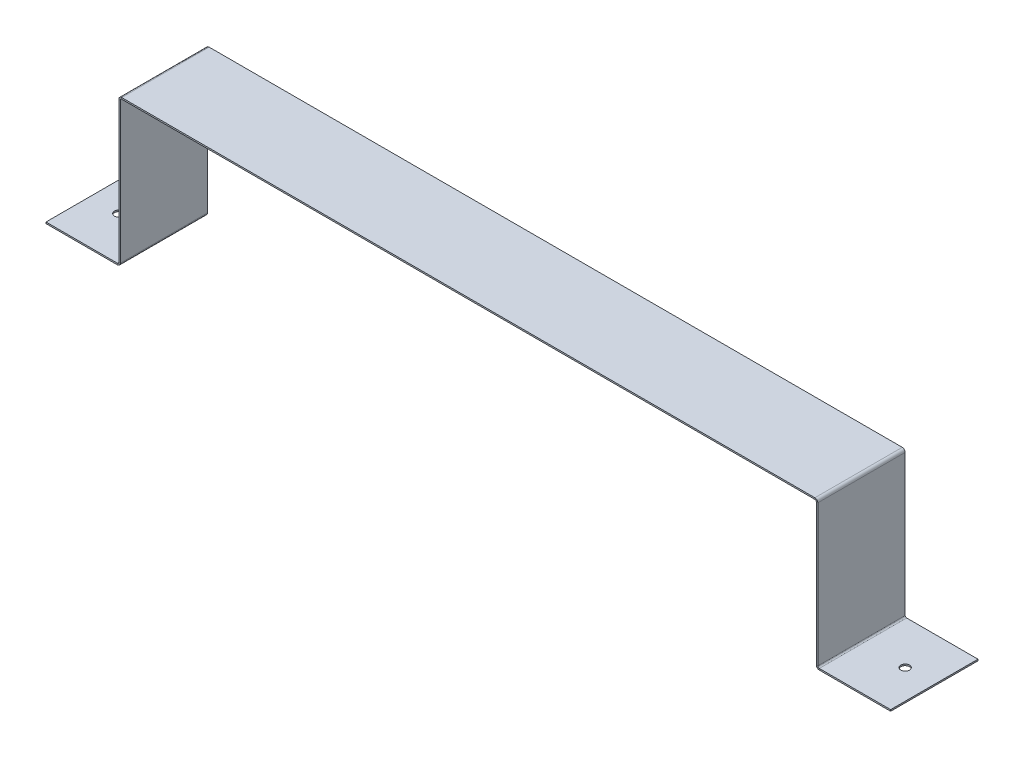
from build123d import *

# Parameters (mm, degrees)
BASE_FLANGE1_DEPTH = 30
SKETCH6_R          = 1.5
CUT_EXTRUDE1_DEPTH = 10


# Sheet-metal steps are written as plain solids
with BuildPart() as part:
    # Sketch1 → Base-Flange1 (new body)
    with BuildSketch(Plane.XY):
        with BuildLine():
            Line((-145, 0), (-120.5, 0))
            ThreePointArc((-120.5, 0), (-120.146446609, 0.146446609), (-120, 0.5))
            Line((-120, 0.5), (-120, 49))
            ThreePointArc((-120, 49), (-119.707106781, 49.707106781), (-119, 50))
            Line((-119, 50), (119, 50))
            ThreePointArc((119, 50), (119.707106781, 49.707106781), (120, 49))
            Line((120, 49), (120, 0.5))
            ThreePointArc((120, 0.5), (120.146446609, 0.146446609), (120.5, 0))
            Line((120.5, 0), (145, 0))
            Line((145, 0), (145, -0.5))
            Line((145, -0.5), (120.5, -0.5))
            ThreePointArc((120.5, -0.5), (119.792893219, -0.207106781), (119.5, 0.5))
            Line((119.5, 0.5), (119.5, 49))
            ThreePointArc((119.5, 49), (119.353553391, 49.353553391), (119, 49.5))
            Line((119, 49.5), (-119, 49.5))
            ThreePointArc((-119, 49.5), (-119.353553391, 49.353553391), (-119.5, 49))
            Line((-119.5, 49), (-119.5, 0.5))
            ThreePointArc((-119.5, 0.5), (-119.792893219, -0.207106781), (-120.5, -0.5))
            Line((-120.5, -0.5), (-145, -0.5))
            Line((-145, -0.5), (-145, 0))
        make_face()
    extrude(amount=BASE_FLANGE1_DEPTH)

    # Sketch6 → Cut-Extrude1 (cut)
    with BuildSketch(Plane(origin=(0, 0, 0), x_dir=(1, 0, 0), z_dir=(0, 1, 0))):
        with Locations(Location((135, -15, 0), (0, 0, 270))):
            Circle(SKETCH6_R)
        with Locations(Location((-135, -15, 0), (0, 0, 90))):
            Circle(SKETCH6_R)
    extrude(amount=-CUT_EXTRUDE1_DEPTH, mode=Mode.SUBTRACT)


solid = part.part
